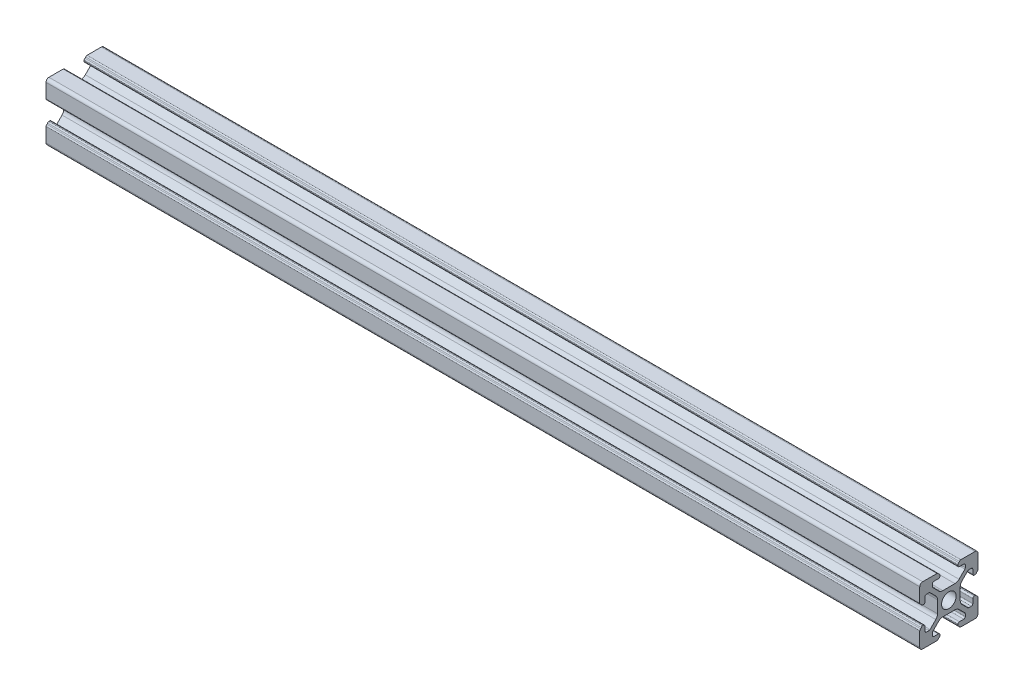
from build123d import *

# Parameters (mm, degrees)
SKETCH1_W                = 20
SKETCH1_H                = 20
BOSS_EXTRUDE1_DEPTH      = 300
FILLET1_R                = 1
CUT_EXTRUDE1_DEPTH       = 301.333148354
F_5_0_5_DIAMETER_HOLE1_D = 5
FILLET2_R                = 2
FILLET3_R                = 0.5
FILLET4_R                = 0.5
FILLET5_R                = 0.5


with BuildPart() as part:
    # Sketch1 → Boss-Extrude1 (new body)
    with BuildSketch(Plane(origin=(0, 0, 0), x_dir=(0, 0, -1), z_dir=(1, 0, 0))):
        Rectangle(SKETCH1_W, SKETCH1_H)
    extrude(amount=BOSS_EXTRUDE1_DEPTH)

    # Fillet1
    fillet1_edges = [part.edges().sort_by_distance(p)[0] for p in [
        (150, 10, 10),
        (150, 10, -10),
        (150, -10, -10),
        (150, -10, 10),
    ]]
    fillet(fillet1_edges, radius=FILLET1_R)

    # Sketch3 → Cut-Extrude1 (cut, through all)
    with BuildSketch(Plane.ZY):
        Polygon((-3.6, 10), (3.6, 10), (3.6, 9.5), (3.1, 9.5), (3.1, 8.2), (5.63, 8.2), (5.63, 6.619949494), (2.910050506, 3.9), (-2.910050506, 3.9), (-5.63, 6.619949494), (-5.63, 8.2), (-3.1, 8.2), (-3.1, 9.5), (-3.6, 9.5), align=None)
        Polygon((10, 3.6), (10, -3.6), (9.5, -3.6), (9.5, -3.1), (8.2, -3.1), (8.2, -5.63), (6.619949494, -5.63), (3.9, -2.910050506), (3.9, 2.910050506), (6.619949494, 5.63), (8.2, 5.63), (8.2, 3.1), (9.5, 3.1), (9.5, 3.6), align=None)
        Polygon((3.6, -10), (-3.6, -10), (-3.6, -9.5), (-3.1, -9.5), (-3.1, -8.2), (-5.63, -8.2), (-5.63, -6.619949494), (-2.910050506, -3.9), (2.910050506, -3.9), (5.63, -6.619949494), (5.63, -8.2), (3.1, -8.2), (3.1, -9.5), (3.6, -9.5), align=None)
        Polygon((-10, -3.6), (-10, 3.6), (-9.5, 3.6), (-9.5, 3.1), (-8.2, 3.1), (-8.2, 5.63), (-6.619949494, 5.63), (-3.9, 2.910050506), (-3.9, -2.910050506), (-6.619949494, -5.63), (-8.2, -5.63), (-8.2, -3.1), (-9.5, -3.1), (-9.5, -3.6), align=None)
    extrude(amount=-CUT_EXTRUDE1_DEPTH, mode=Mode.SUBTRACT)

    # Ø5.0 (5) Diameter Hole1 (through all)
    with Locations(Plane.ZY):
        with Locations((0, 0)):
            Hole(F_5_0_5_DIAMETER_HOLE1_D / 2)

    # Fillet2
    fillet2_edges = [part.edges().sort_by_distance(p)[0] for p in [
        (150, -3.9, -2.910050506),
        (150, -3.9, 2.910050506),
        (150, 2.910050506, -3.9),
        (150, -2.910050506, -3.9),
        (150, -2.910050506, 3.9),
        (150, 2.910050506, 3.9),
        (150, 3.9, 2.910050506),
        (150, 3.9, -2.910050506),
    ]]
    fillet(fillet2_edges, radius=FILLET2_R)

    # Fillet3
    fillet3_edges = [part.edges().sort_by_distance(p)[0] for p in [
        (150, 3.6, -10),
        (150, 3.1, -9.5),
        (150, 3.1, -8.2),
        (150, 5.63, -8.2),
        (150, 5.63, -6.619949494),
        (150, 3.6, 10),
        (150, 3.1, 9.5),
        (150, 3.1, 8.2),
        (150, 5.63, 8.2),
        (150, 5.63, 6.619949494),
        (150, 6.619949494, 5.63),
        (150, 8.2, 5.63),
        (150, 8.2, 3.1),
        (150, 9.5, 3.1),
        (150, 10, 3.6),
        (150, 9.5, -3.1),
        (150, 10, -3.6),
        (150, 8.2, -3.1),
        (150, 8.2, -5.63),
        (150, 6.619949494, -5.63),
    ]]
    fillet(fillet3_edges, radius=FILLET3_R - 0.0001)  # a hair under: the kernel refuses the full size

    # Fillet4
    fillet4_edges = [part.edges().sort_by_distance(p)[0] for p in [
        (150, -3.6, 10),
        (150, -3.1, 9.5),
        (150, -3.1, 8.2),
        (150, -5.63, 8.2),
        (150, -5.63, 6.619949494),
        (150, -6.619949494, 5.63),
        (150, -8.2, 5.63),
        (150, -8.2, 3.1),
        (150, -10, 3.6),
        (150, -9.5, 3.1),
        (150, -10, -3.6),
        (150, -9.5, -3.1),
        (150, -8.2, -3.1),
        (150, -8.2, -5.63),
        (150, -6.619949494, -5.63),
        (150, -5.63, -6.619949494),
        (150, -5.63, -8.2),
        (150, -3.1, -8.2),
        (150, -3.1, -9.5),
        (150, -3.6, -10),
    ]]
    fillet(fillet4_edges, radius=FILLET4_R - 0.0001)  # a hair under: the kernel refuses the full size

    # Fillet5
    fillet5_edges = [part.edges().sort_by_distance(p)[0] for p in [
        (150, 3.6, 9.5),
        (150, 9.5, 3.6),
        (150, 9.5, -3.6),
        (150, 3.6, -9.5),
        (150, -3.6, 9.5),
        (150, -9.5, 3.6),
        (150, -9.5, -3.6),
        (150, -3.6, -9.5),
    ]]
    fillet(fillet5_edges, radius=FILLET5_R)


solid = part.part
